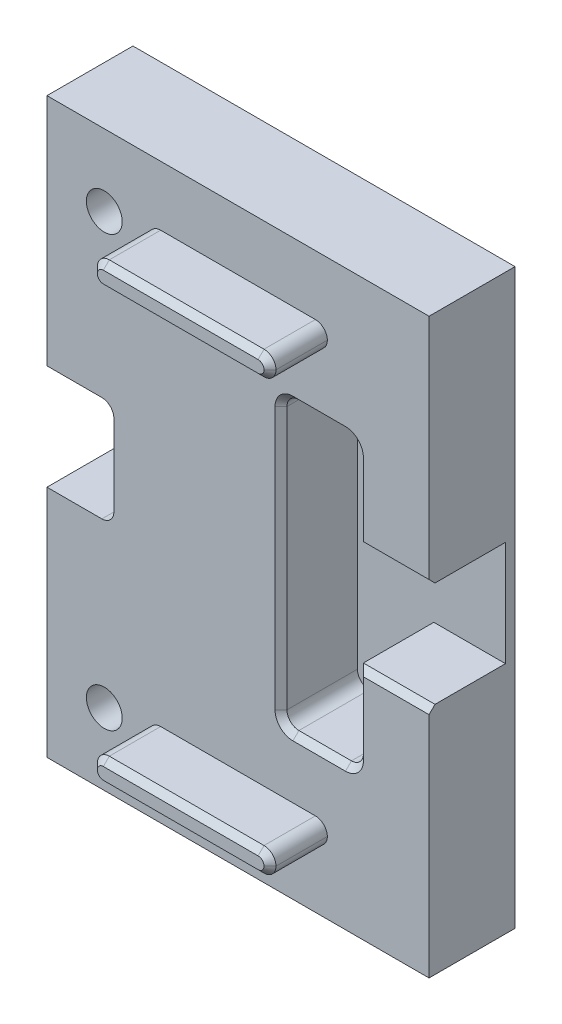
from build123d import *

# Parameters (mm, degrees)
SKETCH1_W           = 76.2
SKETCH1_H           = 50.8
BOSS_EXTRUDE1_DEPTH = 2.54
SKETCH2_W           = 50.8
SKETCH2_H           = 76.2
BOSS_EXTRUDE2_DEPTH = 8.89
CUT_EXTRUDE1_DEPTH  = 10.16
SKETCH4_W           = 8.89
SKETCH4_H           = 13.97
CUT_EXTRUDE2_DEPTH  = 48.195496607
SKETCH5_R           = 2.38125
CUT_EXTRUDE3_DEPTH  = 48.195496607
SKETCH9_W           = 23.749
SKETCH9_H           = 3.175
BOSS_EXTRUDE4_DEPTH = 7.62
FILLET1_R           = 1.5875
CHAMFER2_SIZE       = 0.79375


with BuildPart() as part:
    # Sketch1 → Boss-Extrude1 (new body)
    with BuildSketch(Plane(origin=(0, 0, 0), x_dir=(0, 1, 0), z_dir=(0, 0, 1))):
        Rectangle(SKETCH1_W, SKETCH1_H)
    extrude(amount=-BOSS_EXTRUDE1_DEPTH)

    # Sketch2 → Boss-Extrude2 (add)
    with BuildSketch(Plane.XY):
        Rectangle(SKETCH2_W, SKETCH2_H)
    extrude(amount=BOSS_EXTRUDE2_DEPTH)

    # Sketch3 → Cut-Extrude1 (cut)
    with BuildSketch(Plane.XY.offset(8.89)):
        Polygon((5.715, 19.05), (5.715, -19.05), (15.875, -19.05), (15.875, -6.985), (25.4, -6.985), (25.4, 6.985), (15.875, 6.985), (15.875, 19.05), align=None)
    extrude(amount=-CUT_EXTRUDE1_DEPTH, mode=Mode.SUBTRACT)

    # Sketch4 → Cut-Extrude2 (cut, through all)
    with BuildSketch(Plane.XY.offset(8.89)):
        with Locations((-20.955, 0)):
            Rectangle(SKETCH4_W, SKETCH4_H)
    extrude(amount=-CUT_EXTRUDE2_DEPTH, mode=Mode.SUBTRACT)

    # Sketch5 → Cut-Extrude3 (cut, through all)
    with BuildSketch(Plane.XY.offset(8.89)):
        with Locations((-17.78, -28.575)):
            Circle(SKETCH5_R)
        with Locations((-17.78, 28.575)):
            Circle(SKETCH5_R)
    extrude(amount=-CUT_EXTRUDE3_DEPTH, mode=Mode.SUBTRACT)

    # Sketch9 → Boss-Extrude4 (add)
    with BuildSketch(Plane.XY.offset(8.89)):
        with Locations((0, 28.575)):
            Rectangle(SKETCH9_W, SKETCH9_H)
        with Locations((0, -28.575)):
            Rectangle(SKETCH9_W, SKETCH9_H)
    extrude(amount=BOSS_EXTRUDE4_DEPTH)

    # Fillet1
    fillet1_edges = [part.edges().sort_by_distance(p)[0] for p in [
        (5.715, 19.05, 3.81),
        (15.875, 19.05, 3.81),
        (5.715, -19.05, 3.81),
        (15.875, -19.05, 3.81),
        (-16.51, 6.985, 3.175),
        (-16.51, -6.985, 3.175),
        (-11.8745, 30.1625, 12.7),
        (-11.8745, 26.9875, 12.7),
        (11.8745, 30.1625, 12.7),
        (11.8745, 26.9875, 12.7),
        (-11.8745, -26.9875, 12.7),
        (-11.8745, -30.1625, 12.7),
        (11.8745, -26.9875, 12.7),
        (11.8745, -30.1625, 12.7),
    ]]
    fillet(fillet1_edges, radius=FILLET1_R - 0.0001)  # a hair under: the kernel refuses the full size

    # Chamfer2
    chamfer2_edges = [part.edges().sort_by_distance(p)[0] for p in [
        (0, -26.9875, 16.51),
        (0, -30.1625, 16.51),
        (11.409561304, -29.697561304, 16.51),
        (11.409561304, -27.452438696, 16.51),
        (-11.409561304, -29.697561304, 16.51),
        (-11.409561304, -27.452438696, 16.51),
        (0, 30.1625, 16.51),
        (0, 26.9875, 16.51),
        (11.409561304, 27.452438696, 16.51),
        (11.409561304, 29.697561304, 16.51),
        (-11.409561304, 27.452438696, 16.51),
        (-11.409561304, 29.697561304, 16.51),
        (5.715, 0, 8.89),
        (10.795, 19.05, 8.89),
        (10.795, -19.05, 8.89),
        (15.875, -12.2238, 8.89),
        (6.179938696, 18.585061304, 8.89),
        (15.410061304, 18.585061304, 8.89),
        (6.179938696, -18.585061304, 8.89),
        (15.410061304, -18.585061304, 8.89),
        (20.6375, -6.985, 8.89),
        (20.6375, 6.985, 8.89),
        (15.875, 12.2238, 8.89),
    ]]
    chamfer(chamfer2_edges, length=CHAMFER2_SIZE)


solid = part.part
